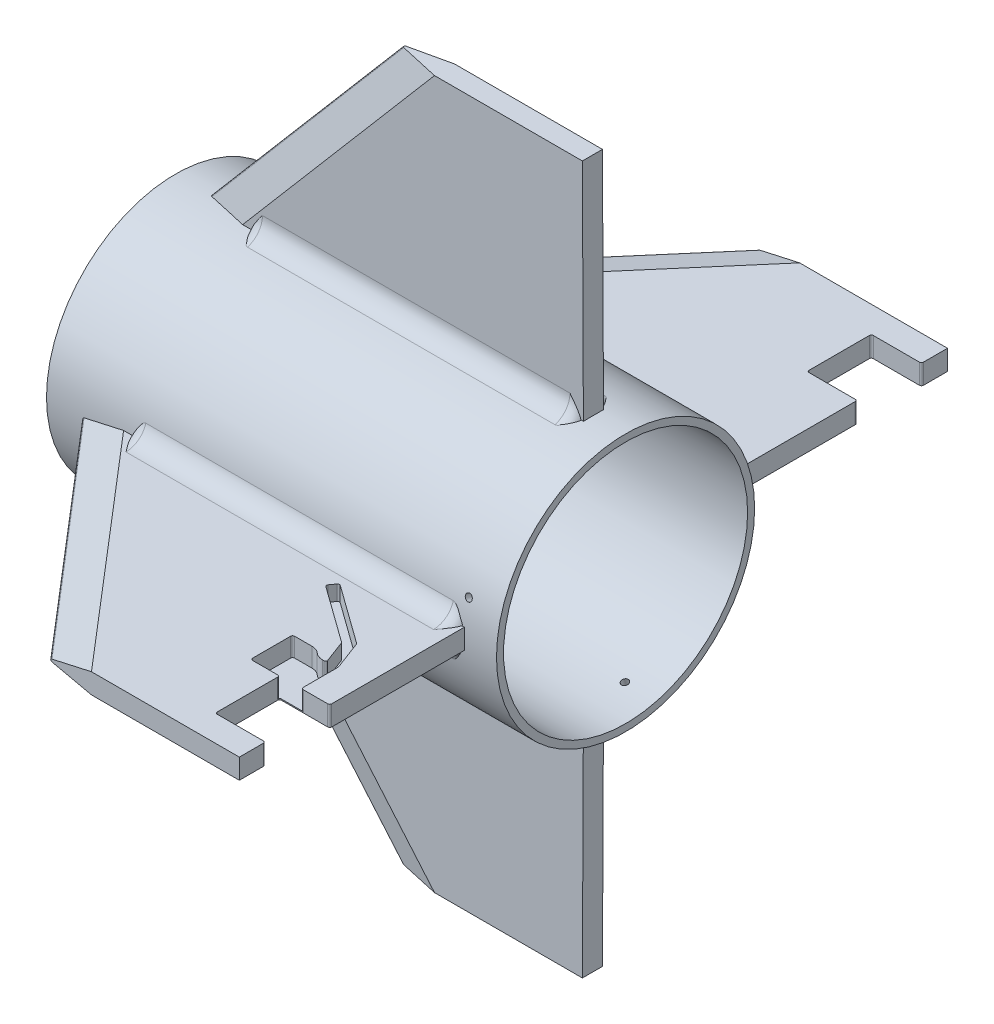
from build123d import *

# Parameters (mm, degrees)
BOSS_EXTRUDE1_DEPTH         = 7.9375
CUT_EXTRUDE11_DEPTH         = 117.08821460761963
CUT_EXTRUDE12_DEPTH         = 117.08821460761963
CUT_EXTRUDE1_DEPTH          = 179.82534900740697
FILLET25_R                  = 0.79375
CUT_EXTRUDE8_DEPTH          = 7.5
CUT_EXTRUDE17_DEPTH         = 6
FILLET31_R                  = 0.79375
FILLET32_R                  = 0.5
BOSS_EXTRUDE7_DEPTH         = 12.7
BOSS_EXTRUDE7_DEPTH_BACK    = 165.1
SKETCH20_R                  = 50.999999999999986
CIRPATTERN6_COUNT           = 2
BOSS_EXTRUDE11_DEPTH        = 3.96875
BOSS_EXTRUDE11_DEPTH_BACK   = 3.96875
BOSS_EXTRUDE11_2_DEPTH      = 3.96875
BOSS_EXTRUDE11_2_DEPTH_BACK = 3.96875
CUT_EXTRUDE14_START         = 20
CUT_EXTRUDE14_DEPTH         = 167.16005103
CUT_EXTRUDE15_DEPTH         = 116.82830075068001
SKETCH24_R                  = 48.220456959221764
CUT_EXTRUDE16_DEPTH         = 389.3321489595131
BOSS_EXTRUDE13_START        = -144.5
BOSS_EXTRUDE13_DEPTH        = 131.5
BOSS_EXTRUDE13_2_DEPTH      = 131.5
FILLET35_R                  = 5
CIRPATTERN9_COUNT           = 4
FILLET33_R                  = 0.5
FILLET34_R                  = 0.5
CIRPATTERN10_COUNT          = 3


with BuildPart() as part:
    # Sketch2 → Boss-Extrude1 (new body)
    with BuildSketch(Plane(origin=(0, 0, 0), x_dir=(1, 0, 0), z_dir=(0, 1, 0))):
        Polygon((129.578799100381, 34.08307349011091), (129.578799100381, 122.98307349011088), (-22.821200899618923, 122.98307349011088), (53.378799100381016, 34.08307349011091), align=None)
    extrude(amount=BOSS_EXTRUDE1_DEPTH)

    # Sketch40 → Cut-Extrude11 (cut, along a direction that is not the sketch's normal)
    with BuildSketch(Plane(origin=(0, 0, -122.98307349011088), x_dir=(-1, 0, 9e-17), z_dir=(-9e-17, 0, -1))):
        Polygon((22.821200899618923, 3.96875), (5.047308928571692, 0), (22.821200899618923, 0), align=None)
    extrude(amount=-CUT_EXTRUDE11_DEPTH, dir=(-0.6507913734559684, 0, -0.7592566023652968), mode=Mode.SUBTRACT)

    # Sketch41 → Cut-Extrude12 (cut, along a direction that is not the sketch's normal)
    with BuildSketch(Plane(origin=(0, 0, -122.98307349011088), x_dir=(-1, 0, 9e-17), z_dir=(-9e-17, 0, -1))):
        Polygon((22.821200899618923, 3.96875), (22.821200899618923, 7.9375), (5.047308928571692, 7.9375), align=None)
    extrude(amount=-CUT_EXTRUDE12_DEPTH, dir=(-0.6507913734559684, 0, -0.7592566023652968), mode=Mode.SUBTRACT)

    # Sketch3 → Cut-Extrude1 (cut, through all)
    with BuildSketch(Plane(origin=(0, 7.9375, 0), x_dir=(1, 0, 0), z_dir=(0, 1, 0))):
        Polygon((129.578799100381, 44.376990288153266), (109.76679910038101, 44.376990288153266), (109.766799100381, 69.77699028815323), (129.578799100381, 69.77699028815326), align=None)
    extrude(amount=-CUT_EXTRUDE1_DEPTH, mode=Mode.SUBTRACT)

    # Fillet25
    fillet25_edges = [part.edges().sort_by_distance(p)[0] for p in [
        (129.578799100381, 3.96875, -69.77699028815326),
        (129.578799100381, 3.96875, -44.376990288153266),
        (109.76679910038101, 3.96875, -44.376990288153266),
        (109.766799100381, 3.96875, -69.77699028815323),
    ]]
    fillet(fillet25_edges, radius=FILLET25_R)

    # Sketch4 → Cut-Extrude8 (cut)
    with BuildSketch(Plane(origin=(0, 7.9375, 0), x_dir=(1, 0, 0), z_dir=(0, 1, 0))):
        with BuildLine():
            Line((114.38886728193765, 83.772796571891), (118.34476999706176, 83.77038063856614))
            Line((118.34476999706176, 83.77038063856614), (118.34476999706177, 69.77504741292461))
            Line((118.34476999706177, 69.77504741292461), (98.64476999681881, 69.77504741292461))
            Line((98.64476999681881, 69.77504741292461), (98.34476999706175, 69.77504741292461))
            Line((98.34476999706175, 69.77504741292461), (98.34476999706175, 70.07504741292463))
            Line((98.34476999706175, 70.07504741292463), (98.34476999706175, 86.372796571891))
            Line((98.34476999706175, 86.372796571891), (106.00504374863394, 86.372796571891))
            ThreePointArc((106.00504374863394, 86.372796571891), (107.7943157739571, 86.04168355053976), (109.34660729275068, 85.09219881964941))
            ThreePointArc((109.34660729275068, 85.09219881964941), (110.91873787519799, 84.12436308965822), (112.7311124369536, 83.772796571891))
            Line((112.7311124369536, 83.772796571891), (114.38886728193765, 83.772796571891))
        make_face()
    extrude(amount=-CUT_EXTRUDE8_DEPTH, mode=Mode.SUBTRACT)

    # Sketch51 → Cut-Extrude17 (cut)
    with BuildSketch(Plane(origin=(0, 7.9375, 0), x_dir=(1, 0, 0), z_dir=(0, 1, 0))):
        Polygon((114.02099774897324, 83.77053928565032), (118.08499774897324, 83.77053928565032), (118.34476999706176, 83.77038063856614), (118.34476999706176, 84.49126354636535), (118.08499774897324, 85.17952160611463), (113.9784946626064, 96.05956698191704), (90.08257802128014, 113.26243443110016), (87.70816292361903, 109.96421537470034), (110.60918840148778, 93.4775782785192), (114.02099774897324, 84.4381012019123), align=None)
    extrude(amount=-CUT_EXTRUDE17_DEPTH, mode=Mode.SUBTRACT)

    # Fillet31
    # the kernel refuses this fillet: 0.79375 mm, written as the material it adds along each edge
    with BuildSketch(Plane(origin=(98.34476999706175, 7.9375, -69.77504741292461), x_dir=(0, 0, -1), z_dir=(0, -1, 0))) as fillet31_piece_1_section:
        with BuildLine():
            CenterArc((FILLET31_R, FILLET31_R), FILLET31_R, 180, 90)
            Line((0, FILLET31_R), (0, 0))
            Line((0, 0), (FILLET31_R, 0))
        make_face()
    fillet31_piece_1 = extrude(amount=9.484375000000007, mode=Mode.PRIVATE)
    fillet31_piece_1 = split(fillet31_piece_1, bisect_by=Plane(origin=(98.34476999706175, 0, -69.77504741292461), z_dir=(0, 1, 0)), keep=Keep.TOP, mode=Mode.PRIVATE)
    add(fillet31_piece_1)
    with BuildSketch(Plane(origin=(98.34476999706175, 7.9375, -86.372796571891), x_dir=(1, 0, 0), z_dir=(0, -1, 0))) as fillet31_piece_2_section:
        with BuildLine():
            CenterArc((FILLET31_R, FILLET31_R), FILLET31_R, 180, 90)
            Line((0, FILLET31_R), (0, 0))
            Line((0, 0), (FILLET31_R, 0))
        make_face()
    fillet31_piece_2 = extrude(amount=9.484375000000007, mode=Mode.PRIVATE)
    fillet31_piece_2 = split(fillet31_piece_2, bisect_by=Plane(origin=(98.34476999706175, 0, -86.372796571891), z_dir=(0, 1, 0)), keep=Keep.TOP, mode=Mode.PRIVATE)
    add(fillet31_piece_2)
    with BuildSketch(Plane(origin=(90.08257802128014, 7.9375, -113.26243443110016), x_dir=(0.8115696497046823, 0, 0.5842556834796042), z_dir=(0, -1, 0))) as fillet31_piece_3_section:
        with BuildLine():
            CenterArc((FILLET31_R, FILLET31_R), FILLET31_R, 180.00000000000082, 89.9999999999992)
            Line((-8.34e-15, FILLET31_R), (0, 0))
            Line((0, 0), (FILLET31_R, 4e-17))
        make_face()
    fillet31_piece_3 = extrude(amount=7.984375, mode=Mode.PRIVATE)
    fillet31_piece_3 = split(fillet31_piece_3, bisect_by=Plane(origin=(90.08257802128014, 0, -113.26243443110016), z_dir=(0, 1, 0)), keep=Keep.TOP, mode=Mode.PRIVATE)
    add(fillet31_piece_3)
    with BuildSketch(Plane(origin=(87.70816292361903, 7.9375, -109.96421537470034), x_dir=(0.5842556834796074, 0, -0.8115696497046798), z_dir=(0, -1, 0))) as fillet31_piece_4_section:
        with BuildLine():
            CenterArc((FILLET31_R, FILLET31_R), FILLET31_R, 179.99999999999977, 90)
            Line((2.301e-14, FILLET31_R), (0, 0))
            Line((0, 0), (FILLET31_R, 4e-17))
        make_face()
    fillet31_piece_4 = extrude(amount=7.9843750000000515, mode=Mode.PRIVATE)
    fillet31_piece_4 = split(fillet31_piece_4, bisect_by=Plane(origin=(87.70816292361903, 0, -109.96421537470034), z_dir=(0, 1, 0)), keep=Keep.TOP, mode=Mode.PRIVATE)
    add(fillet31_piece_4)
    with BuildSketch(Plane(origin=(113.9784946626064, 7.9375, -96.05956698191704), x_dir=(0.3531193948810711, 0, 0.9355782666131286), z_dir=(0, -1, 0))) as fillet31_piece_5:
        with BuildLine():
            CenterArc((FILLET31_R * 0.301644962462, FILLET31_R), FILLET31_R, 236.4286552316418, 33.57134476834494)
            Line((-FILLET31_R * 0.251329950239, FILLET31_R * 0.166802096784), (0, 0))
            Line((0, 0), (FILLET31_R * 0.301644962461, 0))
        make_face()
    extrude(amount=6.59857672238453)
    with BuildSketch(Plane(origin=(118.34476999706176, 7.9375, -84.49126354636535), x_dir=(0, 0, 1), z_dir=(0, -1, 0))) as fillet31_piece_6:
        with BuildLine():
            CenterArc((FILLET31_R * 0.182436123081, FILLET31_R), FILLET31_R, 249.32176961917497, 20.678230380825028)
            Line((-FILLET31_R * 0.1706832718, FILLET31_R * 0.0644217333869), (0, 0))
            Line((0, 0), (FILLET31_R * 0.182436123081, 0))
        make_face()
    extrude(amount=6.362021681739435)
    # the kernel refuses this fillet: 0.79375 mm, written as the material it takes off along each edge
    with BuildSketch(Plane(origin=(118.34476999706177, 9.921875000000007, -69.77699028815324), x_dir=(1, 0, 0), z_dir=(0, -1, 0))) as fillet31_2_piece_1:
        with BuildLine():
            CenterArc((FILLET31_R, -FILLET31_R), FILLET31_R, 90, 90)
            Line((0, -FILLET31_R), (0, 0))
            Line((0, 0), (FILLET31_R, 0))
        make_face()
    extrude(amount=9.484375000000007, mode=Mode.SUBTRACT)
    with BuildSketch(Plane(origin=(110.50504649088127, 11.7674934762507, -69.77504741292461), x_dir=(-0.6810422676251633, 0, 0.7322441052736277), z_dir=(0, -1, 0))) as fillet31_2_piece_2:
        with BuildLine():
            CenterArc((1.624573735383077, 0.5812187585609441), FILLET31_R, 137.0748567037113, 90)
            Line((1.0433549768221329, 1.1217960584884195), (0.9852331009660396, 1.175853788481166))
            Line((0.9852331009660396, 1.175853788481166), (-0.05812187585609337, 0.05405772999274656))
            Line((-0.05812187585609337, 0.05405772999274656), (0.05419964765946971, -0.05798955784095605))
            ThreePointArc((0.05419964765946971, -0.05798955784095605), (1.0285160465294148, -0.05679869570468003), (1.029938705462855, -0.0581218758560933))
            Line((1.029938705462855, -0.0581218758560933), (1.0839964354556018, 1.1e-16))
        make_face()
    extrude(amount=11.3299934762507, mode=Mode.SUBTRACT)
    with BuildSketch(Plane(origin=(110.60918840148778, 8.536076722384541, -93.4775782785192), x_dir=(0.3531193948812985, 0, 0.9355782666130427), z_dir=(0, -1, 0))) as fillet31_2_piece_3:
        with BuildLine():
            CenterArc((FILLET31_R * 0.301644962461, FILLET31_R), FILLET31_R, 236.42865523165432, 33.57134476834676)
            Line((-FILLET31_R * 0.251329950239, FILLET31_R * 0.166802096784), (0, 0))
            Line((0, 0), (FILLET31_R * 0.301644962462, 0))
        make_face()
    extrude(amount=6.598576722384541, mode=Mode.SUBTRACT)
    with BuildSketch(Plane(origin=(114.02099774897324, 9.895721210421414, -83.772796571891), x_dir=(-1, 0, 0), z_dir=(0, -1, 0))) as fillet31_2_piece_4:
        with BuildLine():
            CenterArc((0.7832884841685654, 0.7937500000000028), FILLET31_R, 189.3126058325243, 80.6873941674757)
            Line((2.842e-14, 0.6653046300212964), (0, 0))
            Line((0, 0), (0.7832884841685654, 0))
        make_face()
    extrude(amount=7.958221210421414, mode=Mode.SUBTRACT)

    # Fillet32
    fillet32_edges = [part.edges().sort_by_distance(p)[0] for p in [
        (15.278799100381057, 3.96875, -78.5330734901109),
    ]]
    fillet(fillet32_edges, radius=FILLET32_R)


with BuildPart() as body_2:
    # Sketch20 → Boss-Extrude7 (new, two sides: drawn at the far end of the back side and taken through both)
    with BuildSketch(Plane(origin=(129.578799100381, 0, 0), x_dir=(0, 0, -1), z_dir=(1, 0, 0)).offset(-BOSS_EXTRUDE7_DEPTH_BACK)):
        with Locations((173.98307349011088, 3.96875)):
            Circle(SKETCH20_R)
    extrude(amount=BOSS_EXTRUDE7_DEPTH + BOSS_EXTRUDE7_DEPTH_BACK)

    # Sketch24 → Cut-Extrude16 (cut, through all)
    with BuildSketch(Plane(origin=(142.27879910038098, 0, 0), x_dir=(0, 0, -1), z_dir=(1, 0, 0))):
        with Locations((173.98307349011088, 3.96875)):
            Circle(SKETCH24_R)
    extrude(amount=-CUT_EXTRUDE16_DEPTH, mode=Mode.SUBTRACT)

    # Sketch50 → #6-32 Tapped Hole0 (revolve, cut)
    with BuildSketch(Plane(origin=(129.578799100381, 40.00360188885196, -210.0731132822868), x_dir=(0, 0.7071067811865476, 0.7071067811865476), z_dir=(1, 0, 0))):
        Polygon((0, 0), (-1.249e-14, 51.000000000000036), (1.3525499999999933, 51.000000000000036), (1.3525499999999937, -1e-17), align=None)
    f_6_32_tapped_hole0 = revolve(axis=Axis((129.578799100381, 44.493729949386534, -214.56324134282139), (0, -0.7071067811865474, 0.7071067811865476)), mode=Mode.SUBTRACT)

    # CirPattern10: #6-32 Tapped Hole0 ×3 about axis
    cirpattern10_axis = Axis((142.27879910038098, 3.96875, -173.98307349011088), (1, 0, 0))
    for i in range(1, CIRPATTERN10_COUNT):
        add(f_6_32_tapped_hole0.rotate(cirpattern10_axis, i * 360 / CIRPATTERN10_COUNT), mode=Mode.SUBTRACT)


with BuildPart() as cirpattern6_1:
    # CirPattern6: pattern copy
    add(part.part.rotate(Axis((0, 3.968750000000607, -173.98307349011094), (1, 0, 0)), 1 * 360 / CIRPATTERN6_COUNT))


with BuildPart() as body_4:
    # Sketch35 → Boss-Extrude11 (new, two sides: drawn at the far end of the back side and taken through both)
    with BuildSketch(Plane(origin=(0, 0, -173.98307349011088), x_dir=(-1, 0, 0), z_dir=(0, 0, -1)).offset(-BOSS_EXTRUDE11_DEPTH_BACK)):
        Polygon((22.82120089961902, -46.91451437745898), (-129.578799100381, -46.91451437745899), (-129.17879910303768, -135.8136144854025), (-52.978799103037666, -135.81361448540252), align=None)
    extrude(amount=BOSS_EXTRUDE11_DEPTH + BOSS_EXTRUDE11_DEPTH_BACK)

    # Cut-Extrude14: read off the stored shape, not the designer's step
    # Cut-Extrude14 outline → Cut-Extrude14 (cut)
    with BuildSketch(Plane(origin=(0, 0, 0), x_dir=(0.7609425682782115, 0.6488192412237473, 0), z_dir=(0.6488192412237473, -0.7609425682782116, 0)).offset(CUT_EXTRUDE14_START)):
        Polygon((-47.804662845, -177.95182349), (-34.27975184, -177.95182349), (-47.804662845, -173.98307349), align=None)
        Polygon((-47.804662845, -170.01432349), (-47.804662845, -173.98307349), (-34.27975184, -170.01432349), align=None)
    extrude(amount=CUT_EXTRUDE14_DEPTH, mode=Mode.SUBTRACT)

    # Fillet33
    fillet33_edges = [body_4.edges().sort_by_distance(p)[0] for p in [
        (15.078799101338426, -91.364064431747, -173.98307349),
    ]]
    fillet(fillet33_edges, radius=FILLET33_R)


with BuildPart() as body_5:
    # Sketch35 → Boss-Extrude11 2 (new, two sides: drawn at the far end of the back side and taken through both)
    with BuildSketch(Plane(origin=(0, 0, -173.98307349011088), x_dir=(-1, 0, 0), z_dir=(0, 0, -1)).offset(-BOSS_EXTRUDE11_2_DEPTH_BACK)):
        Polygon((-129.17879909574506, 143.757474243525), (-129.5787991003203, 54.858374135614476), (22.821200899619004, 54.85823808543894), (-52.978799099684366, 143.75824906586624), align=None)
    extrude(amount=BOSS_EXTRUDE11_2_DEPTH + BOSS_EXTRUDE11_2_DEPTH_BACK)

    # Sketch44 → Cut-Extrude15 (cut, along a direction that is not the sketch's normal)
    with BuildSketch(Plane(origin=(-4.897293761433e-05, 54.858258458284936, 0), x_dir=(0.9999999999996015, 8.927176873295174e-07, 0), z_dir=(8.927176873295174e-07, -0.9999999999996015, 0))):
        Polygon((-22.821151926690483, -170.01432349011088), (-22.821151926690483, -173.98307349011088), (-5.047350809987046, -170.01432349011088), align=None)
        Polygon((-5.047258335578036, -177.95182349011088), (-22.821151926690483, -173.98307349011088), (-22.821151926690483, -177.95182349011088), align=None)
    extrude(amount=-CUT_EXTRUDE15_DEPTH, dir=(-0.6488153918690263, -0.7609458504215934, 0), mode=Mode.SUBTRACT)


with BuildPart() as cut_extrude15_kept_piece:
    # of the separate pieces the step leaves, the one the design keeps (cut_extrude15_pieces_kept)
    add(body_5.part.solids().sort_by_distance((129.178799096, 143.757474244, -177.95182349))[0])

    # Fillet34
    # the kernel refuses this fillet: 0.5 mm, written as the material it takes off along each edge
    with BuildSketch(Plane(origin=(-25.58503698641914, 51.61674654893643, -173.98307349011088), x_dir=(0.7301592046345208, -0.6225653641704646, -0.2815668716713329), z_dir=(0.6488153918690263, 0.7609458504215934, 0))) as fillet34_piece_1:
        with BuildLine():
            CenterArc((FILLET34_R * 3.40785514208, -FILLET34_R), FILLET34_R, 90.00000000000041, 147.292433892939)
            Line((FILLET34_R * 2.86750370188, -FILLET34_R * 1.84143943399), (0, 0))
            Line((0, 0), (FILLET34_R * 3.40785514208, 1e-17))
        make_face()
    extrude(amount=125.34793860587465, mode=Mode.SUBTRACT)


with BuildPart() as body_6:
    # Sketch47 → Boss-Extrude13 (new body)
    with BuildSketch(Plane(origin=(142.27879910038098, 0, 0), x_dir=(0, 0, -1), z_dir=(1, 0, 0)).offset(BOSS_EXTRUDE13_START)):
        with BuildLine():
            Line((170.01432349011088, 54.61221628369689), (164.07901549086787, 54.020485606557585))
            ThreePointArc((164.07901549086787, 54.020485606557585), (168.36317098629107, 56.944341230458235), (170.0143234901109, 61.861313411334365))
            Line((170.0143234901109, 61.861313411334365), (170.01432349011088, 54.61221628369689))
        make_face()
    extrude(amount=BOSS_EXTRUDE13_DEPTH)

    # Fillet17: read off the stored shape, not the designer's step
    # Fillet17 outline → Fillet17 (revolve, cut)
    with BuildSketch(Plane(origin=(0, 61.861313411, -161.867613857), x_dir=(0, 1, 0), z_dir=(0, 0, -1))):
        with BuildLine():
            Line((8.146709633, 2.7787991), (8.146709633, -2.2212009))
            Line((8.146709633, -2.2212009), (10.904966163, -2.2212009))
            Line((10.904966163, -2.2212009), (10.904966163, -1.690494604))
            ThreePointArc((10.904966163, -1.690494604), (8.891787933, 0.152843784), (8.146709633, 2.7787991))
        make_face()
        with BuildLine():
            ThreePointArc((8.146709633, 124.2787991), (8.891787933, 126.904754417), (10.904966163, 128.748092804))
            Line((10.904966163, 128.748092804), (10.904966163, 129.2787991))
            Line((10.904966163, 129.2787991), (8.146709633, 129.2787991))
            Line((8.146709633, 129.2787991), (8.146709633, 124.2787991))
        make_face()
    revolve(axis=Axis((0, 61.861313411, -161.867613857), (1, 0, 0)), mode=Mode.SUBTRACT)


with BuildPart() as body_7:
    # Sketch47 → Boss-Extrude13 2 (new body)
    with BuildSketch(Plane(origin=(142.27879910038098, 0, 0), x_dir=(0, 0, -1), z_dir=(1, 0, 0)).offset(BOSS_EXTRUDE13_START)):
        with BuildLine():
            Line((177.95182349011085, 61.861313411334365), (177.95182349011088, 54.61221628369689))
            Line((177.95182349011088, 54.61221628369689), (183.8871314893539, 54.020485606557585))
            ThreePointArc((183.8871314893539, 54.020485606557585), (179.6029759939307, 56.944341230458235), (177.95182349011085, 61.861313411334365))
        make_face()
    extrude(amount=BOSS_EXTRUDE13_2_DEPTH)

    # Fillet35
    # the kernel refuses this fillet: 5 mm, written as the material it takes off along each edge
    with BuildSketch(Plane(origin=(-2.2212008996190207, 61.86131341133438, -186.0985331235766), x_dir=(0, -0.305926511660132, -0.9520551294244799), z_dir=(0, 0.9520551294244799, -0.305926511660132))) as fillet35_piece_1:
        with BuildLine():
            CenterArc((8.146709633465749 + FILLET35_R, -FILLET35_R), FILLET35_R, 90, 90)
            Line((8.146709633465749 + FILLET35_R, 8.9e-16), (8.146709633465749, 0))
            Line((8.146709633465749, 0), (8.14670963346575, -FILLET35_R))
        make_face()
    revolve(axis=Axis((-2.2212008996190207, 61.86131341133438, -186.0985331235766), (-1, 0, 0)), revolution_arc=250.1225751943043, mode=Mode.SUBTRACT)
    with BuildSketch(Plane(origin=(129.27879910038098, 61.86131341133438, -186.0985331235766), x_dir=(0, -0.3059265116601312, -0.9520551294244801), z_dir=(0, 0.9520551294244801, -0.3059265116601312))) as fillet35_piece_2:
        with BuildLine():
            CenterArc((8.146709633465749 + FILLET35_R, FILLET35_R), FILLET35_R, 180, 90)
            Line((8.146709633465749 + FILLET35_R, 0), (8.146709633465749, 0))
            Line((8.146709633465749, 0), (8.14670963346575, FILLET35_R))
        make_face()
    revolve(axis=Axis((129.27879910038098, 61.86131341133438, -186.0985331235766), (-1, 0, 0)), revolution_arc=250.1225751943043, mode=Mode.SUBTRACT)


with BuildPart() as cirpattern9_1:
    # CirPattern9: pattern copy
    add(body_7.part.rotate(Axis((0, 3.968750000000073, -173.98307349011083), (1, 0, 0)), 1 * 360 / CIRPATTERN9_COUNT))


with BuildPart() as cirpattern9_2:
    # CirPattern9: pattern copy
    add(body_7.part.rotate(Axis((0, 3.968750000000073, -173.98307349011083), (1, 0, 0)), 2 * 360 / CIRPATTERN9_COUNT))


with BuildPart() as cirpattern9_3:
    # CirPattern9: pattern copy
    add(body_7.part.rotate(Axis((0, 3.968750000000073, -173.98307349011083), (1, 0, 0)), 3 * 360 / CIRPATTERN9_COUNT))


with BuildPart() as cirpattern9_4:
    # CirPattern9: pattern copy
    add(body_6.part.rotate(Axis((0, 3.968750000000073, -173.98307349011083), (1, 0, 0)), 1 * 360 / CIRPATTERN9_COUNT))


with BuildPart() as cirpattern9_5:
    # CirPattern9: pattern copy
    add(body_6.part.rotate(Axis((0, 3.968750000000073, -173.98307349011083), (1, 0, 0)), 2 * 360 / CIRPATTERN9_COUNT))


with BuildPart() as cirpattern9_6:
    # CirPattern9: pattern copy
    add(body_6.part.rotate(Axis((0, 3.968750000000073, -173.98307349011083), (1, 0, 0)), 3 * 360 / CIRPATTERN9_COUNT))


solid = Compound([part.part, body_2.part, cirpattern6_1.part, body_4.part, cut_extrude15_kept_piece.part, body_6.part, body_7.part, cirpattern9_1.part, cirpattern9_2.part, cirpattern9_3.part, cirpattern9_4.part, cirpattern9_5.part, cirpattern9_6.part])
